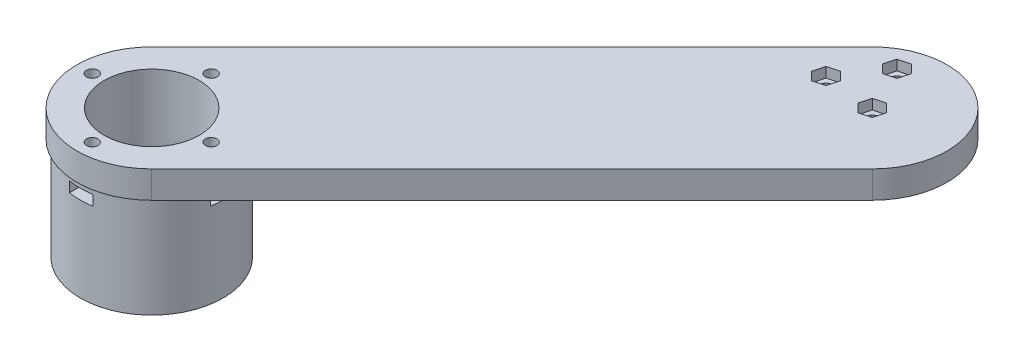
from build123d import *
from build123d.topology import SkipClean

# Parameters (mm, degrees)
BOSS_EXTRUDE1_DEPTH      = 8
SKETCH1_4_R              = 21
SKETCH1_4_R_2            = 14
BOSS_EXTRUDE2_DEPTH      = 30
CUT_EXTRUDE3_START       = -2
SKETCH1_6_R              = 1.7
CUT_EXTRUDE3_DEPTH       = 3
CUT_EXTRUDE4_START       = -2
SKETCH1_7_R              = 1.7
CUT_EXTRUDE4_DEPTH       = 1
CUT_EXTRUDE2_START       = -5
CUT_EXTRUDE2_OUTLINE_R   = 14
CUT_EXTRUDE2_OUTLINE_R_2 = 1.7
CUT_EXTRUDE2_DEPTH       = 13
CUT_EXTRUDE5_START       = 5
SKETCH1_8_R              = 1.7
CUT_EXTRUDE5_DEPTH       = 3
CUT_EXTRUDE6_DEPTH       = 3


# Read off the part's stored shape, not the designer's step: Cut-Extrude2
with BuildPart() as part:
    # Sketch1 → Boss-Extrude1 (new body)
    with BuildSketch(Plane(origin=(0, 0, 0), x_dir=(1, 0, 0), z_dir=(0, 1, 0))):
        with BuildLine():
            Line((-15.556349186, 15.556349186), (90.509667992, 121.622366364))
            ThreePointArc((90.509667992, 121.622366364), (121.622366364, 121.622366364), (121.622366364, 90.509667992))
            Line((121.622366364, 90.509667992), (15.556349186, -15.556349186))
            ThreePointArc((15.556349186, -15.556349186), (-15.556349186, -15.556349186), (-15.556349186, 15.556349186))
        make_face()
    extrude(amount=BOSS_EXTRUDE1_DEPTH)

    # Sketch1<4> → Boss-Extrude2 (add)
    with BuildSketch(Plane(origin=(0, 0, 0), x_dir=(1, 0, 0), z_dir=(0, 1, 0))):
        with Locations(Location((0, 0, 0), (0, 0, 270))):
            Circle(SKETCH1_4_R)
        with Locations(Location((0, 0, 0), (0, 0, 270))):
            Circle(SKETCH1_4_R_2, mode=Mode.SUBTRACT)
    extrude(amount=-BOSS_EXTRUDE2_DEPTH)

    # Sketch1<6> → Cut-Extrude3 (cut)
    # profile 1 of 4: a face of its own
    with BuildSketch(Plane(origin=(0, 0, 0), x_dir=(1, 0, 0), z_dir=(0, 1, 0)).offset(CUT_EXTRUDE3_START)):
        with BuildLine():
            Line((-3.464101615, 17.5), (-1.732050808, 14.5))
            Line((-1.732050808, 14.5), (1.732050808, 14.5))
            Line((1.732050808, 14.5), (3.464101615, 17.5))
            Line((3.464101615, 17.5), (3.464101615, 20.712315177))
            ThreePointArc((3.464101615, 20.712315177), (0, 21), (-3.464101615, 20.712315177))
            Line((-3.464101615, 20.712315177), (-3.464101615, 17.5))
        make_face()
        with Locations(Location((0, 17.5, 0), (0, 0, 270))):
            Circle(SKETCH1_6_R, mode=Mode.SUBTRACT)
    # profile 2 of 4: a face of its own
    with BuildSketch(Plane(origin=(0, 0, 0), x_dir=(1, 0, 0), z_dir=(0, 1, 0)).offset(CUT_EXTRUDE3_START)):
        with BuildLine():
            ThreePointArc((20.712315177, -3.464101615), (21, 0), (20.712315177, 3.464101615))
            Line((20.712315177, 3.464101615), (17.5, 3.464101615))
            Line((17.5, 3.464101615), (14.5, 1.732050808))
            Line((14.5, 1.732050808), (14.5, -1.732050808))
            Line((14.5, -1.732050808), (17.5, -3.464101615))
            Line((17.5, -3.464101615), (20.712315177, -3.464101615))
        make_face()
        with Locations(Location((17.5, 0, 0), (0, 0, 270))):
            Circle(SKETCH1_6_R, mode=Mode.SUBTRACT)
    # profile 3 of 4: a face of its own
    with BuildSketch(Plane(origin=(0, 0, 0), x_dir=(1, 0, 0), z_dir=(0, 1, 0)).offset(CUT_EXTRUDE3_START)):
        with BuildLine():
            Line((-17.5, 3.464101615), (-20.712315177, 3.464101615))
            ThreePointArc((-20.712315177, 3.464101615), (-21, 0), (-20.712315177, -3.464101615))
            Line((-20.712315177, -3.464101615), (-17.5, -3.464101615))
            Line((-17.5, -3.464101615), (-14.5, -1.732050808))
            Line((-14.5, -1.732050808), (-14.5, 1.732050808))
            Line((-14.5, 1.732050808), (-17.5, 3.464101615))
        make_face()
        with Locations(Location((-17.5, 0, 0), (0, 0, 270))):
            Circle(SKETCH1_6_R, mode=Mode.SUBTRACT)
    # profile 4 of 4: a face of its own
    with BuildSketch(Plane(origin=(0, 0, 0), x_dir=(1, 0, 0), z_dir=(0, 1, 0)).offset(CUT_EXTRUDE3_START)):
        with BuildLine():
            ThreePointArc((-3.464101615, -20.712315177), (0, -21), (3.464101615, -20.712315177))
            Line((3.464101615, -20.712315177), (3.464101615, -17.5))
            Line((3.464101615, -17.5), (1.732050808, -14.5))
            Line((1.732050808, -14.5), (-1.732050808, -14.5))
            Line((-1.732050808, -14.5), (-3.464101615, -17.5))
            Line((-3.464101615, -17.5), (-3.464101615, -20.712315177))
        make_face()
        with Locations(Location((0, -17.5, 0), (0, 0, 270))):
            Circle(SKETCH1_6_R, mode=Mode.SUBTRACT)
    extrude(amount=-CUT_EXTRUDE3_DEPTH, mode=Mode.SUBTRACT)

    # Sketch1<7> → Cut-Extrude4 (cut)
    # profile 1 of 4: a face of its own
    with BuildSketch(Plane(origin=(0, 0, 0), x_dir=(1, 0, 0), z_dir=(0, 1, 0)).offset(CUT_EXTRUDE4_START)):
        Polygon((-1.732050808, 20.5), (-3.464101615, 17.5), (-1.732050808, 14.5), (1.732050808, 14.5), (3.464101615, 17.5), (1.732050808, 20.5), align=None)
        with Locations(Location((0, 17.5, 0), (0, 0, 270))):
            Circle(SKETCH1_7_R, mode=Mode.SUBTRACT)
    # profile 2 of 4: a face of its own
    with BuildSketch(Plane(origin=(0, 0, 0), x_dir=(1, 0, 0), z_dir=(0, 1, 0)).offset(CUT_EXTRUDE4_START)):
        Polygon((14.5, -1.732050808), (17.5, -3.464101615), (20.5, -1.732050808), (20.5, 1.732050808), (17.5, 3.464101615), (14.5, 1.732050808), align=None)
        with Locations(Location((17.5, 0, 0), (0, 0, 270))):
            Circle(SKETCH1_7_R, mode=Mode.SUBTRACT)
    # profile 3 of 4: a face of its own
    with BuildSketch(Plane(origin=(0, 0, 0), x_dir=(1, 0, 0), z_dir=(0, 1, 0)).offset(CUT_EXTRUDE4_START)):
        Polygon((-20.5, -1.732050808), (-17.5, -3.464101615), (-14.5, -1.732050808), (-14.5, 1.732050808), (-17.5, 3.464101615), (-20.5, 1.732050808), align=None)
        with Locations(Location((-17.5, 0, 0), (0, 0, 270))):
            Circle(SKETCH1_7_R, mode=Mode.SUBTRACT)
    # profile 4 of 4: a face of its own
    with BuildSketch(Plane(origin=(0, 0, 0), x_dir=(1, 0, 0), z_dir=(0, 1, 0)).offset(CUT_EXTRUDE4_START)):
        Polygon((-1.732050808, -14.5), (-3.464101615, -17.5), (-1.732050808, -20.5), (1.732050808, -20.5), (3.464101615, -17.5), (1.732050808, -14.5), align=None)
        with Locations(Location((0, -17.5, 0), (0, 0, 270))):
            Circle(SKETCH1_7_R, mode=Mode.SUBTRACT)
    extrude(amount=CUT_EXTRUDE4_DEPTH, mode=Mode.SUBTRACT)

    # Cut-Extrude2 outline → Cut-Extrude2 (cut)
    with SkipClean():  # the faces are left unmerged after this step: merging them gives an invalid solid
        with BuildSketch(Plane(origin=(0, 0, 0), x_dir=(1, 0, 0), z_dir=(0, 1, 0)).offset(CUT_EXTRUDE2_START)):
            Circle(CUT_EXTRUDE2_OUTLINE_R)
            with Locations((-17.5, 0)):
                Circle(CUT_EXTRUDE2_OUTLINE_R_2)
            with Locations((0, -17.5)):
                Circle(CUT_EXTRUDE2_OUTLINE_R_2)
            with Locations((17.5, 0)):
                Circle(CUT_EXTRUDE2_OUTLINE_R_2)
            with Locations((0, 17.5)):
                Circle(CUT_EXTRUDE2_OUTLINE_R_2)
            with Locations((99.718863875, 119.666151183)):
                Circle(CUT_EXTRUDE2_OUTLINE_R_2)
            with Locations((106.066017178, 106.066017178)):
                Circle(CUT_EXTRUDE2_OUTLINE_R_2)
            with Locations((91.11521733, 107.378870518)):
                Circle(CUT_EXTRUDE2_OUTLINE_R_2)
        extrude(amount=CUT_EXTRUDE2_DEPTH, mode=Mode.SUBTRACT)

    # Sketch1<8> → Cut-Extrude5 (cut)
    # profile 1 of 3: a face of its own
    with SkipClean():  # the faces are left unmerged after this step: merging them gives an invalid solid
        with BuildSketch(Plane(origin=(0, 0, 0), x_dir=(1, 0, 0), z_dir=(0, 1, 0)).offset(CUT_EXTRUDE5_START)):
            Polygon((102.168353618, 117.21666144), (103.06492909, 120.562726655), (100.615439347, 123.012216398), (97.269374132, 122.115640925), (96.37279866, 118.769575711), (98.822288403, 116.320085968), align=None)
            with Locations(Location((99.718863875, 119.666151183, 0), (0, 0, 270))):
                Circle(SKETCH1_8_R, mode=Mode.SUBTRACT)
        # profile 2 of 3: a face of its own
        with BuildSketch(Plane(origin=(0, 0, 0), x_dir=(1, 0, 0), z_dir=(0, 1, 0)).offset(CUT_EXTRUDE5_START)):
            Polygon((88.665727587, 109.828360261), (87.769152115, 106.482295046), (90.218641857, 104.032805303), (93.564707072, 104.929380776), (94.461282545, 108.275445991), (92.011792802, 110.724935733), align=None)
            with Locations(Location((91.11521733, 107.378870518, 0), (0, 0, 270))):
                Circle(SKETCH1_8_R, mode=Mode.SUBTRACT)
        # profile 3 of 3: a face of its own
        with BuildSketch(Plane(origin=(0, 0, 0), x_dir=(1, 0, 0), z_dir=(0, 1, 0)).offset(CUT_EXTRUDE5_START)):
            Polygon((108.515506921, 103.616527435), (109.412082393, 106.96259265), (106.96259265, 109.412082393), (103.616527435, 108.515506921), (102.719951963, 105.169441706), (105.169441706, 102.719951963), align=None)
            with Locations(Location((106.066017178, 106.066017178, 0), (0, 0, 270))):
                Circle(SKETCH1_8_R, mode=Mode.SUBTRACT)
        extrude(amount=CUT_EXTRUDE5_DEPTH, mode=Mode.SUBTRACT)

    # Sketch1<9> → Cut-Extrude6 (cut)
    with SkipClean():  # the faces are left unmerged after this step: merging them gives an invalid solid
        with BuildSketch(Plane(origin=(0, 0, 0), x_dir=(1, 0, 0), z_dir=(0, 1, 0))):
            with BuildLine():
                Line((97.232940058, 93.451075696), (-9.918409797, 168.479258594))
                ThreePointArc((-9.918409797, 168.479258594), (-13.700274159, 189.927277196), (7.747744443, 193.709141558))
                Line((7.747744443, 193.709141558), (114.899094298, 118.68095866))
                ThreePointArc((114.899094298, 118.68095866), (118.68095866, 97.232940058), (97.232940058, 93.451075696))
            make_face()
        extrude(amount=CUT_EXTRUDE6_DEPTH, mode=Mode.SUBTRACT)


solid = part.part
